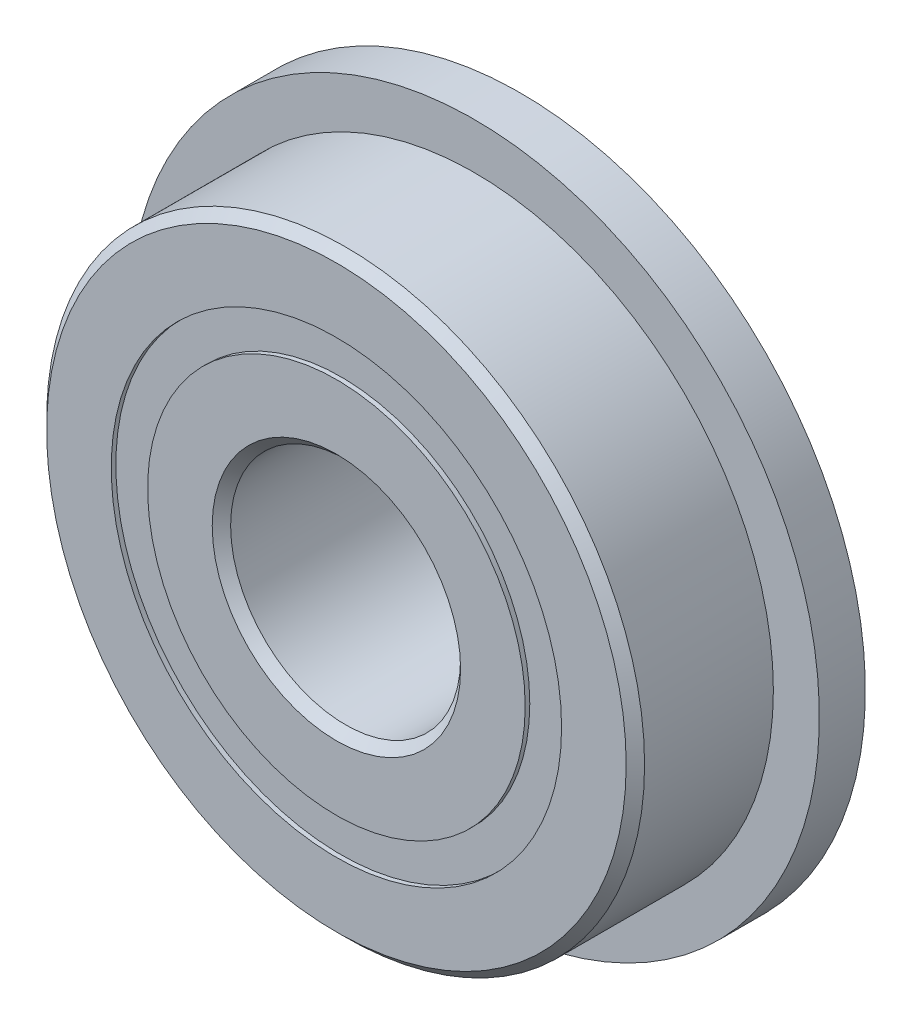
from build123d import *

# Parameters (mm, degrees)
SKETCH5_W = 0.927052779
SKETCH5_H = 0.791208792
SKETCH6_W = 1
SKETCH6_H = 2.604395604


with BuildPart() as part:
    # Sketch1 → Revolve1 (revolve)
    with BuildSketch(Plane(origin=(0, 0, 0), x_dir=(0, 0, -1), z_dir=(1, 0, 0))):
        with BuildLine():
            Line((1.8, 6.5), (-1.8, 6.5))
            Line((-1.8, 6.5), (-2, 6.3))
            Line((-2, 6.3), (-2, 4.895604396))
            Line((-2, 4.895604396), (-0.888888889, 4.895604396))
            ThreePointArc((-0.888888889, 4.895604396), (0, 5.472947221), (0.888888889, 4.895604396))
            Line((0.888888889, 4.895604396), (2, 4.895604396))
            Line((2, 4.895604396), (2, 6.3))
            Line((2, 6.3), (1.8, 6.5))
        make_face()
    revolve(axis=Axis((0, 0, 2), (0, 0, -1)))

    # Sketch6 → Revolve6 (revolve)
    with BuildSketch(Plane(origin=(0, 0, 0), x_dir=(0, 0, -1), z_dir=(1, 0, 0))):
        with Locations((1.5, 6.197802198)):
            Rectangle(SKETCH6_W, SKETCH6_H)
    revolve(axis=Axis((0, 0, -2), (0, 0, 1)))


with BuildPart() as body_2:
    # Sketch3 → Revolve3 (revolve)
    with BuildSketch(Plane(origin=(0, 0, 0), x_dir=(0, 0, -1), z_dir=(1, 0, 0))):
        with BuildLine():
            Line((-2, 4.104395604), (-0.888888889, 4.104395604))
            ThreePointArc((-0.888888889, 4.104395604), (0, 3.527052779), (0.888888889, 4.104395604))
            Line((0.888888889, 4.104395604), (2, 4.104395604))
            Line((2, 4.104395604), (2, 2.7))
            Line((2, 2.7), (1.8, 2.5))
            Line((1.8, 2.5), (-1.8, 2.5))
            Line((-1.8, 2.5), (-2, 2.7))
            Line((-2, 2.7), (-2, 4.104395604))
        make_face()
    revolve(axis=Axis((0, 0, 2), (0, 0, -1)))


with BuildPart() as body_3:
    # Sketch5 → Revolve5 (revolve)
    with BuildSketch(Plane(origin=(0, 0, 0), x_dir=(0, 0, -1), z_dir=(1, 0, 0))):
        with Locations((-1.436473611, 4.5)):
            Rectangle(SKETCH5_W, SKETCH5_H)
        with Locations((1.436473611, 4.5)):
            Rectangle(SKETCH5_W, SKETCH5_H)
    revolve(axis=Axis((0, 0, 2), (0, 0, -1)))


solid = Compound([part.part, body_2.part, body_3.part])
